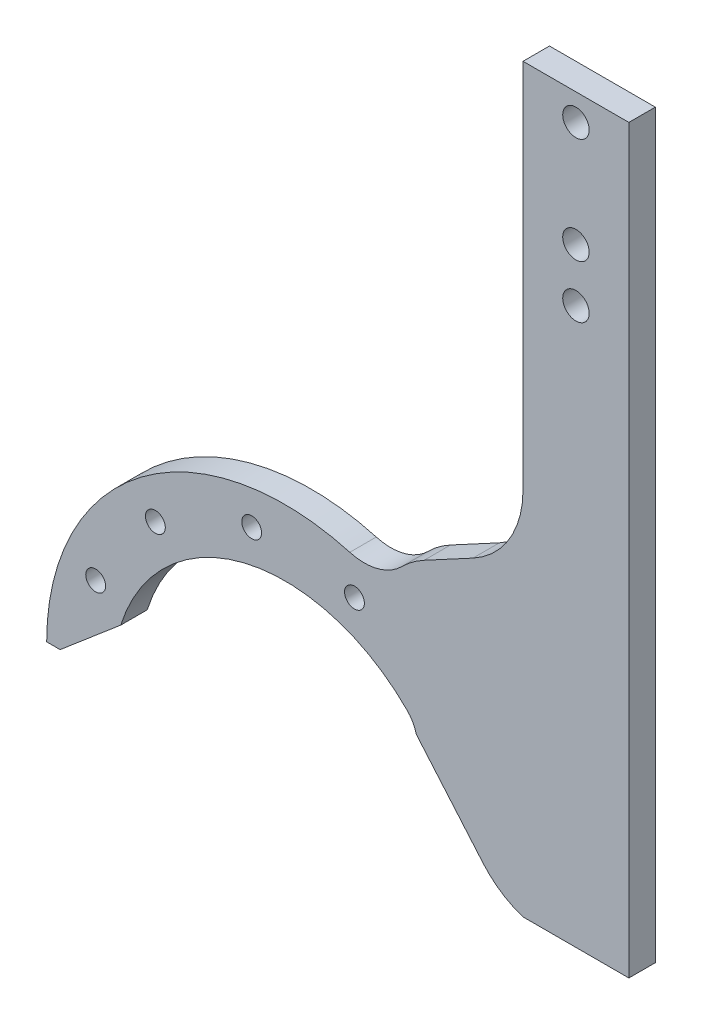
from build123d import *

# Parameters (mm, degrees)
BOSS_EXTRUDE1_DEPTH = 6.35
FILLET1_R           = 8.255
SKETCH2_R           = 3.175
CUT_EXTRUDE1_DEPTH  = 128.158650905
CHAMFER2_START      = -126.7457463
CHAMFER2_OUTLINE_W  = 36
CHAMFER2_OUTLINE_H  = 6.35
CHAMFER2_DEPTH      = 83.771913248
FILLET4_R           = 20.955
FILLET5_R           = 12.7
SKETCH3_W           = 25.4
SKETCH3_H           = 25.4
SKETCH3_R           = 3.175
BOSS_EXTRUDE2_DEPTH = 6.35
SKETCH4_W           = 25.4
SKETCH4_H           = 177.8
SKETCH4_R           = 3.175
BOSS_EXTRUDE3_DEPTH = 6.35
SKETCH5_W           = 25.4
SKETCH5_H           = 101.6
CUT_EXTRUDE2_DEPTH  = 144.824345992
CHAMFER3_DEPTH      = 6.35
FILLET7_R           = 22.86
SKETCH6_R           = 2.38125
CUT_EXTRUDE3_DEPTH  = 144.824345992


with BuildPart() as part:
    # Sketch1 → Boss-Extrude1 (new body)
    with BuildSketch(Plane.XY):
        with BuildLine():
            Line((12.7, 76.2), (-12.7, 76.2))
            Line((-12.7, 76.2), (-12.7, -28.680951188))
            ThreePointArc((-12.7, -28.680951188), (-71.390768363, -25.798437524), (-101.6, -76.2))
            Line((-101.6, -76.2), (-85.725, -76.2))
            ThreePointArc((-85.725, -76.2), (-58.470420375, -37.379213847), (-12.7, -49.826469235))
            Line((-12.7, -49.826469235), (-12.7, -76.2))
            Line((-12.7, -76.2), (12.7, -76.2))
            Line((12.7, -76.2), (12.7, 76.2))
        make_face()
    extrude(amount=BOSS_EXTRUDE1_DEPTH)

    # Fillet1
    fillet1_edges = [part.edges().sort_by_distance(p)[0] for p in [
        (-12.7, -49.826469235, 3.175),
    ]]
    fillet(fillet1_edges, radius=FILLET1_R)

    # Chamfer1
    # the kernel refuses this chamfer: 16.925734726, 15.24 mm, written as the material it takes off along each edge
    with BuildSketch(Plane(origin=(-85.725, -76.2, -32.922584323), x_dir=(0.15149402541241913, 0.9884581732498049, 0), z_dir=(0, 0, 1))) as chamfer1_piece_1:
        with BuildLine():
            Line((13.017434015, -0.44343203), (-2.4273823, 12.943386903))
            Line((-2.4273823, 12.943386903), (-2.761989917, 12.89210395))
            ThreePointArc((-2.761989917, 12.89210395), (-1.331569383, 6.453627085), (-0.334607617, -0.051282954))
            Line((-0.334607617, -0.051282954), (0.051282954, -0.334607617))
            ThreePointArc((0.051282954, -0.334607617), (6.510978775, 0.137060785), (12.966151061, -0.778039646))
            Line((12.966151061, -0.778039646), (13.017434015, -0.44343203))
        make_face()
    extrude(amount=72.195168646, mode=Mode.SUBTRACT)

    # Sketch2 → Cut-Extrude1 (cut, through all)
    with BuildSketch(Plane.XY.offset(6.35)):
        with Locations((0, 57.15)):
            Circle(SKETCH2_R)
        with Locations((0, 69.85)):
            Circle(SKETCH2_R)
    extrude(amount=-CUT_EXTRUDE1_DEPTH, mode=Mode.SUBTRACT)

    # Chamfer2: read off the stored shape, not the designer's step
    # Chamfer2 outline → Chamfer2 (cut)
    with BuildSketch(Plane(origin=(0, 0, 0), x_dir=(0.6493951635681026, -0.7604511302735748, 0), z_dir=(0.7604511302735747, 0.6493951635681027, 0)).offset(CHAMFER2_START)):
        with Locations((47, -3.175)):
            Rectangle(CHAMFER2_OUTLINE_W, CHAMFER2_OUTLINE_H)
    extrude(amount=CHAMFER2_DEPTH, mode=Mode.SUBTRACT)

    # Fillet4
    # the kernel refuses this fillet: 20.955 mm, written as the material it takes off along each edge
    with BuildSketch(Plane(origin=(8.560811014, -76.2, 27.244649936), x_dir=(1, 0, 0), z_dir=(0, 0, -1))) as fillet4_piece_1:
        with BuildLine():
            CenterArc((10.50769959, -19.963819717), FILLET4_R, 107.692818626, 31.811166067)
            Line((-5.427553845, -6.355744064), (-5.746258914, -6.083582551))
            Line((-5.746258914, -6.083582551), (-0.318705069, 0.272161513))
            Line((-0.318705069, 0.272161513), (0, 0.4191))
            ThreePointArc((0, 0.4191), (2.069594493, 0.4191), (4.011818774, 0.399276394))
            Line((4.011818774, 0.399276394), (4.139188986, 0))
        make_face()
    extrude(amount=48.139299873, mode=Mode.SUBTRACT)

    # Fillet5
    fillet5_edges = [part.edges().sort_by_distance(p)[0] for p in [
        (-12.7, -28.680951188, 3.175),
    ]]
    fillet(fillet5_edges, radius=FILLET5_R)

    # Sketch3 → Boss-Extrude2 (add)
    with BuildSketch(Plane.XY.offset(6.35)):
        with Locations((0, 88.9)):
            Rectangle(SKETCH3_W, SKETCH3_H)
        with Locations((0, 95.25)):
            Circle(SKETCH3_R, mode=Mode.SUBTRACT)
    extrude(amount=-BOSS_EXTRUDE2_DEPTH)

    # Sketch4 → Boss-Extrude3 (add)
    with BuildSketch(Plane(origin=(0, 0, 0), x_dir=(-1, 0, 0), z_dir=(0, 0, -1))):
        with Locations((-25.4, 12.7)):
            Rectangle(SKETCH4_W, SKETCH4_H)
        with Locations((-25.4, 95.25)):
            Circle(SKETCH4_R, mode=Mode.SUBTRACT)
        with Locations((-25.4, 69.85)):
            Circle(SKETCH4_R, mode=Mode.SUBTRACT)
        with Locations((-25.4, 57.15)):
            Circle(SKETCH4_R, mode=Mode.SUBTRACT)
    extrude(amount=-BOSS_EXTRUDE3_DEPTH)

    # Sketch5 → Cut-Extrude2 (cut, through all)
    with BuildSketch(Plane(origin=(0, 0, 0), x_dir=(-1, 0, 0), z_dir=(0, 0, -1))):
        with Locations((0, 50.8)):
            Rectangle(SKETCH5_W, SKETCH5_H)
    extrude(amount=-CUT_EXTRUDE2_DEPTH, mode=Mode.SUBTRACT)

    # Chamfer3: read off the stored shape, not the designer's step
    # Chamfer3 outline → Chamfer3 (cut)
    with BuildSketch(Plane.XY):
        with BuildLine():
            ThreePointArc((-12.7, -8.997916699), (-13.235467867, -12.646773779), (-14.796717794, -15.98793862))
            Line((-14.796717794, -15.98793862), (12.7, -1.180669249))
            Line((12.7, -1.180669249), (12.7, 0))
            Line((12.7, 0), (-12.7, 0))
            Line((-12.7, 0), (-12.7, -8.997916699))
        make_face()
    extrude(amount=CHAMFER3_DEPTH, mode=Mode.SUBTRACT)

    # Fillet7
    fillet7_edges = [part.edges().sort_by_distance(p)[0] for p in [
        (-14.796717794, -15.98793862, 3.175),
        (12.7, -1.180669249, 3.175),
    ]]
    fillet(fillet7_edges, radius=FILLET7_R)

    # Sketch6 → Cut-Extrude3 (cut, through all)
    with BuildSketch(Plane(origin=(0, 0, 0), x_dir=(-1, 0, 0), z_dir=(0, 0, -1))):
        with Locations((89.842397197, -57.554736727)):
            Circle(SKETCH6_R)
        with Locations((75.517874882, -38.214440689)):
            Circle(SKETCH6_R)
        with Locations((52.406792333, -27.776813182)):
            Circle(SKETCH6_R)
        with Locations((27.741530006, -30.059534069)):
            Circle(SKETCH6_R)
    extrude(amount=-CUT_EXTRUDE3_DEPTH, mode=Mode.SUBTRACT)


solid = part.part
